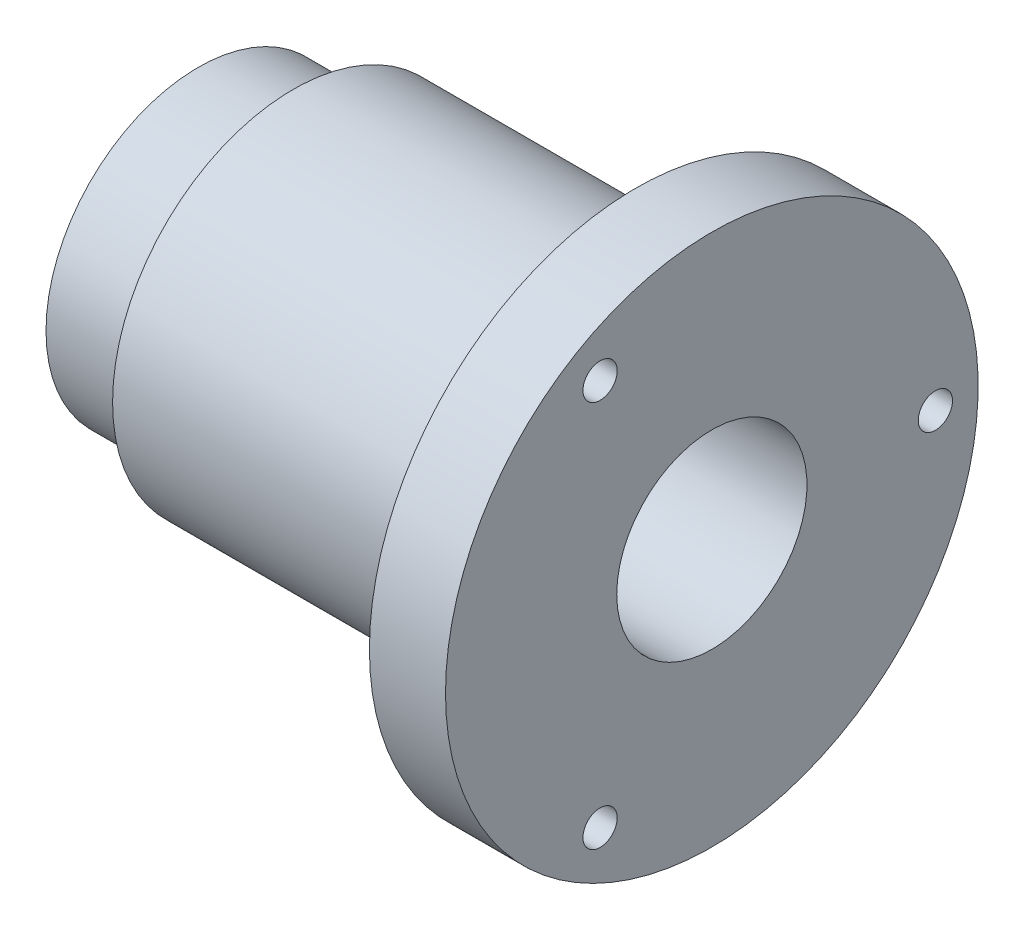
from build123d import *

# Parameters (mm, degrees)
SKETCH2_R          = 0.9
CUT_EXTRUDE1_DEPTH = 31.347981811
CIRPATTERN1_COUNT  = 3


with BuildPart() as part:
    # Sketch1 → Revolve1 (revolve)
    with BuildSketch(Plane(origin=(0, 0, 0), x_dir=(1, 0, 0), z_dir=(0, 1, 0))):
        Polygon((0, 5), (27, 5), (27, 14), (23, 14), (23, 9.5), (5, 9.5), (5, 8), (0, 8), align=None)
    revolve(axis=Axis((0, 0, 0), (1, 0, 0)))

    # Sketch2 → Cut-Extrude1 (cut, through all)
    with BuildSketch(Plane.ZY.offset(-23)):
        with Locations((-11.75, 0)):
            Circle(SKETCH2_R)
    cut_extrude1 = extrude(amount=-CUT_EXTRUDE1_DEPTH, mode=Mode.SUBTRACT)

    # CirPattern1: Cut-Extrude1 ×3 about axis
    cirpattern1_axis = Axis((0, 0, 0), (-1, 0, 0))
    for i in range(1, CIRPATTERN1_COUNT):
        add(cut_extrude1.rotate(cirpattern1_axis, i * 360 / CIRPATTERN1_COUNT), mode=Mode.SUBTRACT)


solid = part.part
